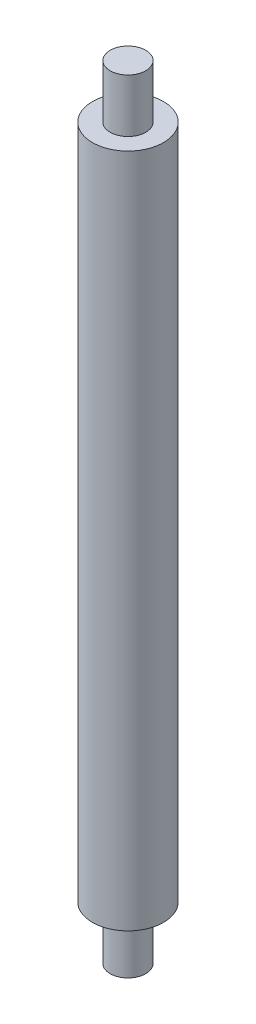
from build123d import *


with BuildPart() as part:
    # Esquisse1 → Révolution1 (revolve)
    with BuildSketch(Plane.XY):
        Polygon((0, 11), (0.5, 11), (0.5, 9.5), (1, 9.5), (1, -9.5), (0.5, -9.5), (0.5, -11), (0, -11), align=None)
    revolve(axis=Axis((0, 11, 0), (0, -1, 0)))


solid = part.part
